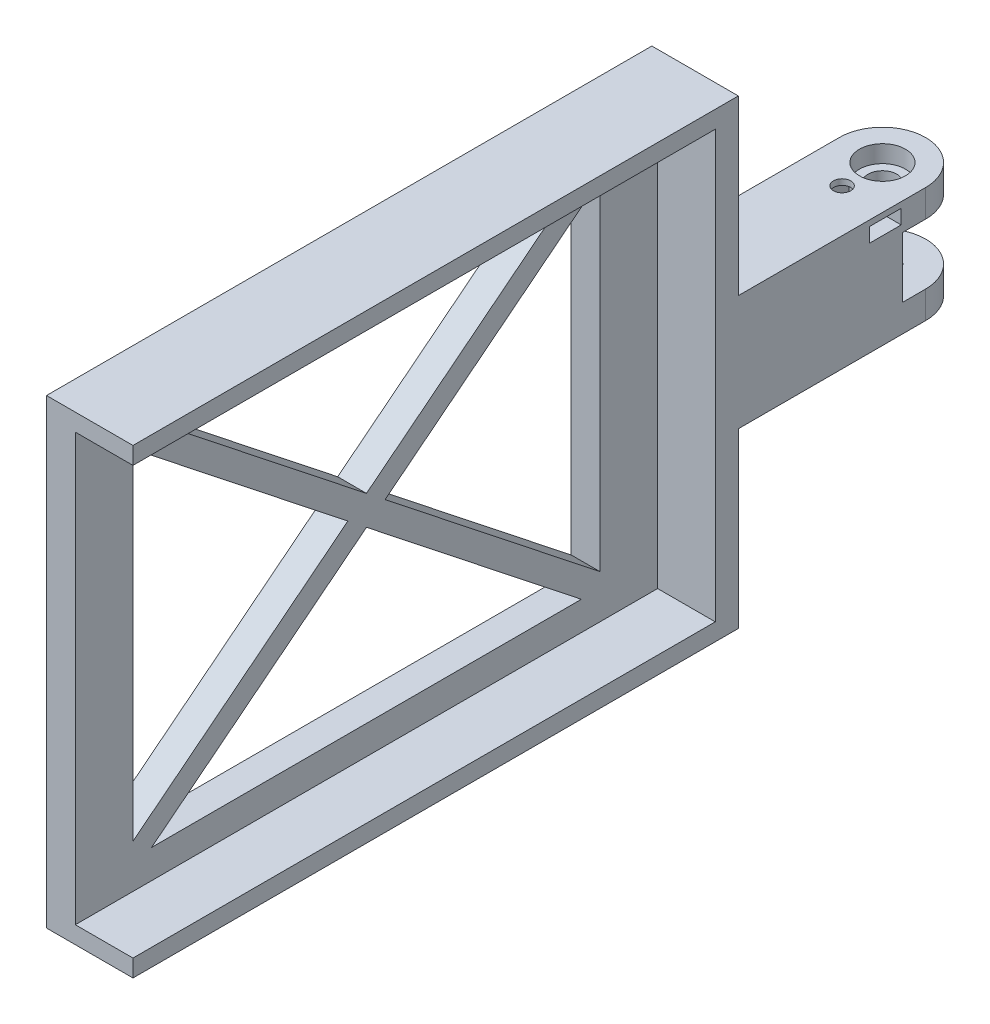
from build123d import *

# Parameters (mm, degrees)
SKETCH1_W           = 15
SKETCH1_H           = 20
BOSS_EXTRUDE1_DEPTH = 20
FILLET1_R           = 7.5
CUT_EXTRUDE1_START  = -4.75
SKETCH3_R           = 8.5
CUT_EXTRUDE1_DEPTH  = 10.5
SKETCH4_R           = 2.5
CUT_EXTRUDE2_DEPTH  = 30.261749777
CUT_EXTRUDE3_DEPTH  = 3
SKETCH6_R           = 4
CUT_EXTRUDE4_DEPTH  = 3
SKETCH7_W           = 105
SKETCH7_H           = 80
BOSS_EXTRUDE2_DEPTH = 15
SKETCH9_W           = 101
SKETCH9_H           = 74
CUT_EXTRUDE5_DEPTH  = 10
CUT_EXTRUDE6_DEPTH  = 132.624465811
CUT_EXTRUDE7_START  = -1
CUT_EXTRUDE7_DEPTH  = 2.5
SKETCH13_R          = 1.5
CUT_EXTRUDE8_DEPTH  = 7


with BuildPart() as part:
    # Sketch1 → Boss-Extrude1 (new, symmetric)
    with BuildSketch(Plane.XY):
        Rectangle(SKETCH1_W, SKETCH1_H)
    extrude(amount=BOSS_EXTRUDE1_DEPTH, both=True)

    # Fillet1
    fillet1_edges = [part.edges().sort_by_distance(p)[0] for p in [
        (-7.5, 0, -20),
        (7.5, 0, -20),
    ]]
    fillet(fillet1_edges, radius=FILLET1_R - 0.0001)  # a hair under: the kernel refuses the full size

    # Sketch3 → Cut-Extrude1 (cut)
    with BuildSketch(Plane(origin=(0, 10, 0), x_dir=(1, 0, 0), z_dir=(0, 1, 0)).offset(CUT_EXTRUDE1_START)):
        with Locations((0, 12.5)):
            Circle(SKETCH3_R)
    extrude(amount=-CUT_EXTRUDE1_DEPTH, mode=Mode.SUBTRACT)

    # Sketch4 → Cut-Extrude2 (cut, through all)
    with BuildSketch(Plane(origin=(0, 10, 0), x_dir=(1, 0, 0), z_dir=(0, 1, 0))):
        with Locations(Location((0, 12.5, 0), (0, 0, 270))):
            Circle(SKETCH4_R)
    extrude(amount=-CUT_EXTRUDE2_DEPTH, mode=Mode.SUBTRACT)

    # Sketch5 → Cut-Extrude3 (cut)
    with BuildSketch(Plane(origin=(0, -10, 0), x_dir=(-1, 0, 0), z_dir=(0, -1, 0))):
        Polygon((-2.020725942, 16), (-4.041451884, 12.5), (-2.020725942, 9), (2.020725942, 9), (4.041451884, 12.5), (2.020725942, 16), align=None)
    extrude(amount=-CUT_EXTRUDE3_DEPTH, mode=Mode.SUBTRACT)

    # Sketch6 → Cut-Extrude4 (cut)
    with BuildSketch(Plane(origin=(0, 10, 0), x_dir=(1, 0, 0), z_dir=(0, 1, 0))):
        with Locations(Location((0, 12.5, 0), (0, 0, 270))):
            Circle(SKETCH6_R)
    extrude(amount=-CUT_EXTRUDE4_DEPTH, mode=Mode.SUBTRACT)

    # Sketch7 → Boss-Extrude2 (add)
    with BuildSketch(Plane.ZY.offset(7.5)):
        with Locations((72.5, 0)):
            Rectangle(SKETCH7_W, SKETCH7_H)
    extrude(amount=-BOSS_EXTRUDE2_DEPTH)

    # Sketch9 → Cut-Extrude5 (cut)
    with BuildSketch(Plane(origin=(7.5, 0, 0), x_dir=(0, 0, -1), z_dir=(1, 0, 0))):
        with Locations((-74.5, 0)):
            Rectangle(SKETCH9_W, SKETCH9_H)
    extrude(amount=-CUT_EXTRUDE5_DEPTH, mode=Mode.SUBTRACT)

    # Sketch10 → Cut-Extrude6 (cut, through all)
    with BuildSketch(Plane(origin=(-2.5, 0, 0), x_dir=(0, 0, -1), z_dir=(1, 0, 0))):
        Polygon((-111.773976664, -32), (-74.5, -2.54895671), (-37.226023336, -32), align=None)
        Polygon((-115, -29.45104329), (-77.726023336, 0), (-115, 29.45104329), align=None)
        Polygon((-37.226023336, 32), (-111.773976664, 32), (-74.5, 2.54895671), align=None)
        Polygon((-71.273976664, 0), (-34, 29.45104329), (-34, -29.45104329), align=None)
    extrude(amount=-CUT_EXTRUDE6_DEPTH, mode=Mode.SUBTRACT)

    # Sketch12 → Cut-Extrude7 (cut)
    with BuildSketch(Plane(origin=(0, 10, 0), x_dir=(1, 0, 0), z_dir=(0, 1, 0)).offset(CUT_EXTRUDE7_START)):
        Polygon((-1.58771324, 8.25), (-3.175426481, 5.5), (-1.58771324, 2.75), (1.58771324, 2.75), (7.5, 2.75), (7.5, 8.25), (1.58771324, 8.25), align=None)
    extrude(amount=-CUT_EXTRUDE7_DEPTH, mode=Mode.SUBTRACT)

    # Sketch13 → Cut-Extrude8 (cut)
    with BuildSketch(Plane(origin=(0, 10, 0), x_dir=(1, 0, 0), z_dir=(0, 1, 0))):
        with Locations(Location((0, 5.5, 0), (0, 0, 270))):
            Circle(SKETCH13_R)
    extrude(amount=-CUT_EXTRUDE8_DEPTH, mode=Mode.SUBTRACT)


solid = part.part
